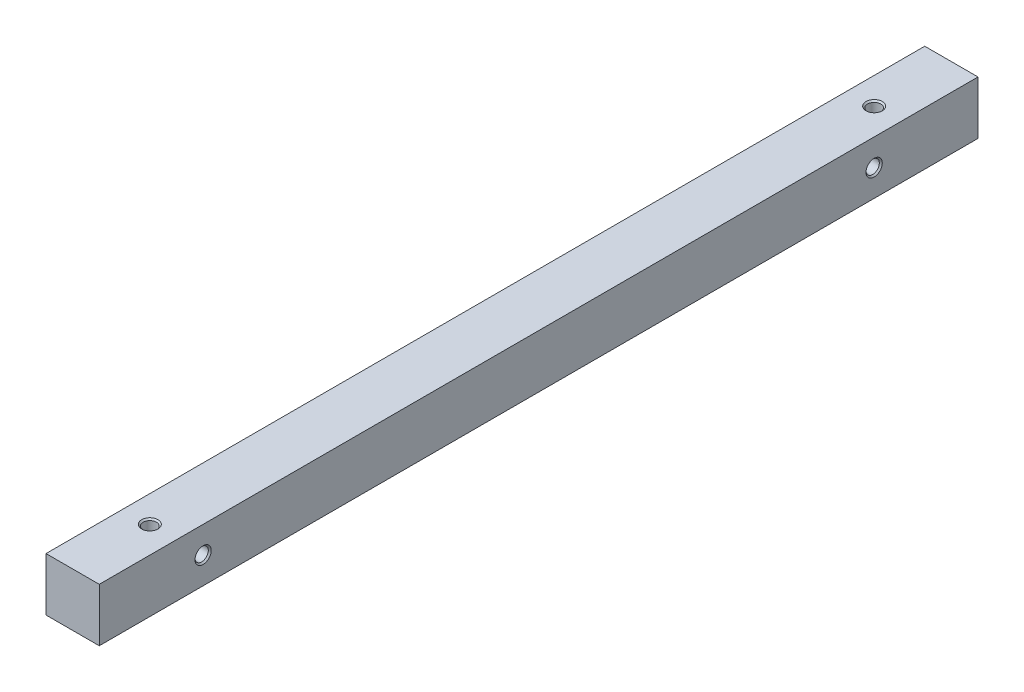
from build123d import *

# Parameters (mm, degrees)
ESQUISSE1_W                     = 10
ESQUISSE1_H                     = 10
BOSS_EXTRU_1_DEPTH              = 82.5
TROU_TARAUD_M3X0_51_D           = 2.5
TROU_TARAUD_M3X0_51_CSINK_D     = 3.05
TROU_TARAUD_M3X0_51_CSINK_ANGLE = 90
TROU_TARAUD_M3X0_52_D           = 2.5
TROU_TARAUD_M3X0_52_CSINK_D     = 3.05
TROU_TARAUD_M3X0_52_CSINK_ANGLE = 90


with BuildPart() as part:
    # Esquisse1 → Boss.-Extru.1 (new, symmetric)
    with BuildSketch(Plane.XY):
        Rectangle(ESQUISSE1_W, ESQUISSE1_H)
    extrude(amount=BOSS_EXTRU_1_DEPTH, both=True)

    # Trou taraudé M3x0.51 (through all)
    with Locations(Plane(origin=(5, 0, 0), x_dir=(0, 0, -1), z_dir=(1, 0, 0))):
        with Locations((63, 0), (-63, 0)):
            CounterSinkHole(TROU_TARAUD_M3X0_51_D / 2, TROU_TARAUD_M3X0_51_CSINK_D / 2, counter_sink_angle=TROU_TARAUD_M3X0_51_CSINK_ANGLE)

    # Trou taraudé M3x0.52 (through all)
    with Locations(Plane(origin=(0, 5, 0), x_dir=(1, 0, 0), z_dir=(0, 1, 0))):
        with Locations((0, 68), (0, -68)):
            CounterSinkHole(TROU_TARAUD_M3X0_52_D / 2, TROU_TARAUD_M3X0_52_CSINK_D / 2, counter_sink_angle=TROU_TARAUD_M3X0_52_CSINK_ANGLE)


solid = part.part
